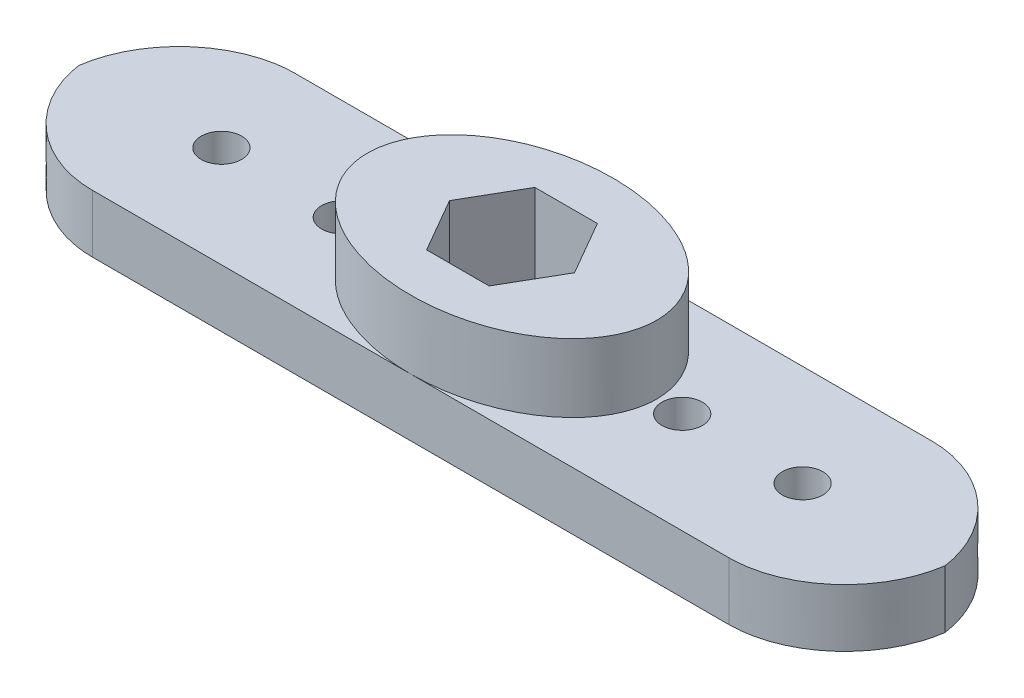
from build123d import *

# Parameters (mm, degrees)
SKETCH1_W               = 38.1
SKETCH1_H               = 8.89
BOSS_EXTRUDE1_DEPTH     = 2.54
FILLET1_SIZE            = 5.08
BOSS_EXTRUDE2_START     = 0.508
SKETCH1_7_RX            = 6.35
SKETCH1_7_RY            = 4.445
BOSS_EXTRUDE2_DEPTH     = 5.0292
CUT_EXTRUDE2_DEPTH      = 40.51332301
CUT_EXTRUDE2_DEPTH_BACK = 5.08
CUT_EXTRUDE2_START      = 6.604
CUT_EXTRUDE3_START      = 1.778
SKETCH2_R               = 0.889
CUT_EXTRUDE3_DEPTH      = 5.08
FILLET2_SIZE            = 5.08
SKETCH6_R               = 3.408948418
CUT_EXTRUDE6_DEPTH      = 1.27
SKETCH2_AGAIN_R         = 0.889
CUT_EXTRUDE5_DEPTH      = 1.2


with BuildPart() as part:
    # Sketch1 → Boss-Extrude1 (new body)
    with BuildSketch(Plane(origin=(0, 0, 0), x_dir=(1, 0, 0), z_dir=(0, 1, 0))):
        with Locations((19.05, 4.445)):
            Rectangle(SKETCH1_W, SKETCH1_H)
        Polygon((20.421149154, 2.0701), (21.792298309, 4.445), (20.421149154, 6.8199), (17.678850846, 6.8199), (16.307701691, 4.445), (17.678850846, 2.0701), align=None, mode=Mode.SUBTRACT)
    extrude(amount=BOSS_EXTRUDE1_DEPTH)

    # Fillet1
    # a fillet whose section is not a circle: 5.08 mm, written as the material it takes off along each edge
    with BuildSketch(Plane(origin=(0, -12.7, -8.89), x_dir=(1, 0, 0), z_dir=(0, 1, 0))) as fillet1_piece_1:
        with BuildLine():
            Bezier((FILLET1_SIZE, 0), (0, 0), (0, -FILLET1_SIZE), weights=[1, 0.666666667, 1])
            Line((0, -FILLET1_SIZE), (0, 0))
            Line((0, 0), (FILLET1_SIZE, 0))
        make_face()
    extrude(amount=27.94, mode=Mode.SUBTRACT)
    with BuildSketch(Plane(origin=(0, -12.7, 0), x_dir=(1, 0, 0), z_dir=(0, 1, 0))) as fillet1_piece_2:
        with BuildLine():
            Bezier((FILLET1_SIZE, 0), (0, 0), (0, FILLET1_SIZE), weights=[1, 0.666666667, 1])
            Line((0, FILLET1_SIZE), (0, 0))
            Line((0, 0), (FILLET1_SIZE, 0))
        make_face()
    extrude(amount=27.94, mode=Mode.SUBTRACT)

    # Sketch1<7> → Boss-Extrude2 (add)
    with BuildSketch(Plane(origin=(0, 0, 0), x_dir=(1, 0, 0), z_dir=(0, 1, 0)).offset(BOSS_EXTRUDE2_START)):
        with Locations(Location((19.05, 4.445), (0, 0, 0))):
            Ellipse(SKETCH1_7_RX, SKETCH1_7_RY)
    extrude(amount=BOSS_EXTRUDE2_DEPTH)

    # Sketch1<8> → Cut-Extrude2 (cut, two sides: drawn at the far end of the back side and taken through both)
    with BuildSketch(Plane(origin=(0, 0, 0), x_dir=(1, 0, 0), z_dir=(0, 1, 0)).offset(CUT_EXTRUDE2_START - CUT_EXTRUDE2_DEPTH_BACK)):
        Polygon((20.421149154, 2.0701), (21.792298309, 4.445), (20.421149154, 6.8199), (17.678850846, 6.8199), (16.307701691, 4.445), (17.678850846, 2.0701), align=None)
    extrude(amount=CUT_EXTRUDE2_DEPTH + CUT_EXTRUDE2_DEPTH_BACK, mode=Mode.SUBTRACT)

    # Sketch2 → Cut-Extrude3 (cut)
    with BuildSketch(Plane(origin=(0, 2.54, 0), x_dir=(1, 0, 0), z_dir=(0, 1, 0)).offset(CUT_EXTRUDE3_START)):
        with Locations(Location((11.5824, 4.444938661, 0), (0, 0, 270))):
            Circle(SKETCH2_R)
        with Locations(Location((6.2992, 4.444938661, 0), (0, 0, 270))):
            Circle(SKETCH2_R)
        with Locations(Location((26.5176, 4.444938661, 0), (0, 0, 270))):
            Circle(SKETCH2_R)
        with Locations(Location((31.8008, 4.444938661, 0), (0, 0, 270))):
            Circle(SKETCH2_R)
    extrude(amount=-CUT_EXTRUDE3_DEPTH, mode=Mode.SUBTRACT)

    # Fillet2
    # a fillet whose section is not a circle: 5.08 mm, written as the material it takes off along each edge
    with BuildSketch(Plane(origin=(38.1, -12.7, 0), x_dir=(-1, 0, 0), z_dir=(0, 1, 0)), Plane(origin=(38.1, -12.7, -8.89), x_dir=(0, 0, 1), z_dir=(0, 1, 0))) as fillet2_piece_1:
        with BuildLine():
            Bezier((FILLET2_SIZE, 0), (0, 0), (0, -FILLET2_SIZE), weights=[1, 0.666666667, 1])
            Line((0, -FILLET2_SIZE), (0, 0))
            Line((0, 0), (FILLET2_SIZE, 0))
        make_face()
    extrude(amount=27.94, mode=Mode.SUBTRACT)

    # Sketch6 → Cut-Extrude6 (cut)
    with BuildSketch(Plane(origin=(0, 0, 0), x_dir=(1, 0, 0), z_dir=(0, 1, 0))):
        with Locations(Location((19.05, 4.445, 0), (0, 0, 270))):
            Circle(SKETCH6_R)
    extrude(amount=CUT_EXTRUDE6_DEPTH, mode=Mode.SUBTRACT)

    # Sketch2 again → Cut-Extrude5 (cut)
    with BuildSketch(Plane(origin=(0, 2.54, 0), x_dir=(1, 0, 0), z_dir=(0, 1, 0))):
        with Locations(Location((26.5176, 4.444938661, 0), (0, 0, 270))):
            Circle(SKETCH2_AGAIN_R)
    extrude(amount=-CUT_EXTRUDE5_DEPTH, mode=Mode.SUBTRACT)


solid = part.part
